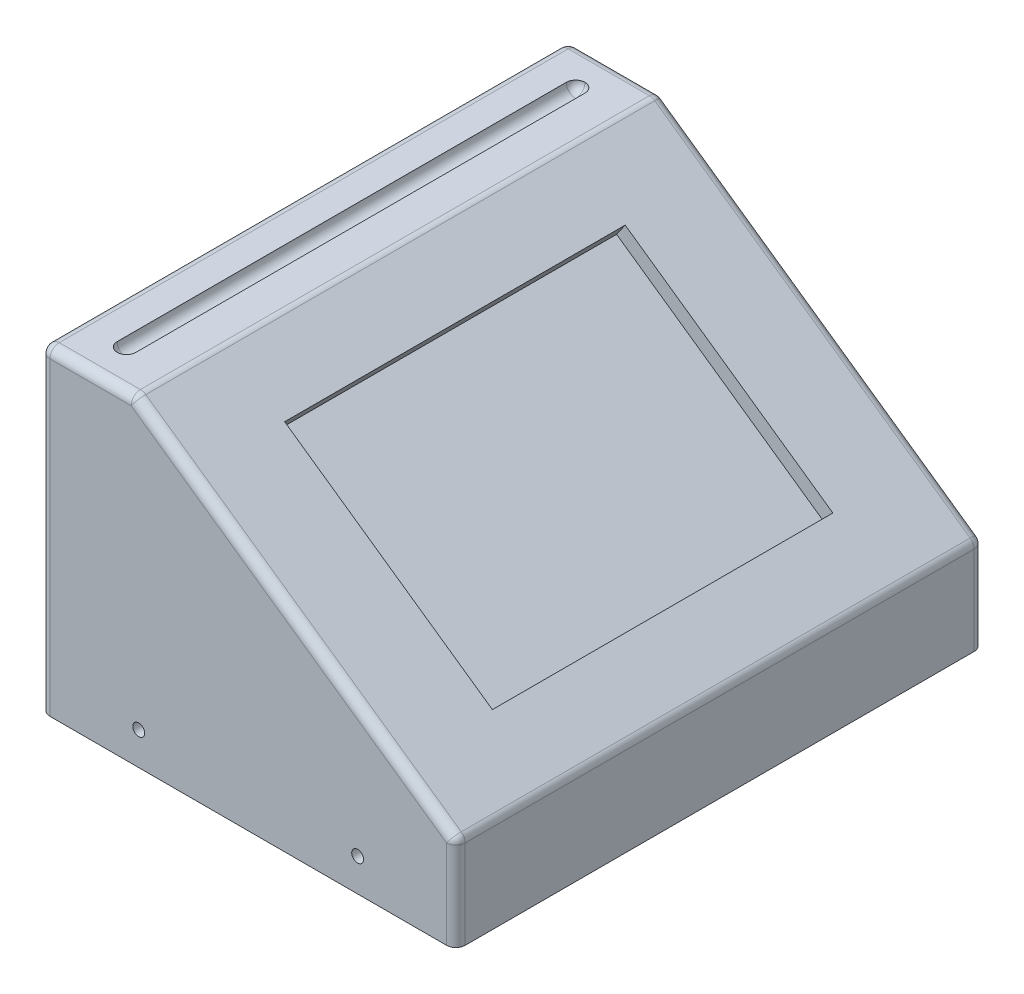
from build123d import *

# Parameters (mm, degrees)
SKETCH1_W           = 50
SKETCH1_H           = 170.451051634
BOSS_EXTRUDE1_DEPTH = 282
CUT_EXTRUDE1_DEPTH  = 8
CUT_EXTRUDE2_DEPTH  = 5
FILLET3_R           = 5
SKETCH5_R           = 3.175
CUT_EXTRUDE3_DEPTH  = 7.7
CUT_EXTRUDE4_START  = -7.7
SKETCH6_R           = 3.175
CUT_EXTRUDE4_DEPTH  = 7.7
FILLET4_R           = 5


with BuildPart() as part:
    # Sketch1 → Boss-Extrude1 (new body)
    with BuildSketch(Plane.XY):
        with Locations((-197.021929301, 35.225525817)):
            Rectangle(SKETCH1_W, SKETCH1_H)
        Polygon((0, -50), (0, 0), (-172.021929301, 120.451051634), (-172.021929301, -50), align=None)
    extrude(amount=BOSS_EXTRUDE1_DEPTH)

    # Sketch3 → Cut-Extrude1 (cut)
    with BuildSketch(Plane(origin=(0, 0, 0), x_dir=(0.819152044288989, -0.5735764363510502, 0), z_dir=(0.5735764363510502, 0.819152044288989, 0))):
        Polygon((-37.234042553, -232), (-172.765957447, -50), (-172.765957447, -232), align=None)
        Polygon((-37.234042553, -50), (-172.765957447, -50), (-37.234042553, -232), align=None)
    extrude(amount=-CUT_EXTRUDE1_DEPTH, mode=Mode.SUBTRACT)

    # Sketch4 → Cut-Extrude2 (cut)
    with BuildSketch(Plane(origin=(0, 120.451051634, 0), x_dir=(1, 0, 0), z_dir=(0, 1, 0))):
        Polygon((-202.021929301, -112.8), (-192.021929301, -169.2), (-192.021929301, -16), (-202.021929301, -16), align=None)
        Polygon((-192.021929301, -266), (-192.021929301, -169.2), (-202.021929301, -112.8), (-202.021929301, -266), align=None)
    extrude(amount=-CUT_EXTRUDE2_DEPTH, mode=Mode.SUBTRACT)

    # Fillet3
    # the kernel refuses this fillet: 5 mm, written as the material it adds along each edge
    with BuildSketch(Plane(origin=(-197.021929301, 120.451051634, 261), x_dir=(0, 0, 1), z_dir=(0, -1, 0))) as fillet3_piece_1_section:
        Polygon((0, 0), (FILLET3_R * 1.02, 0), (FILLET3_R * 1.02, FILLET3_R * 1.02), (0, FILLET3_R * 1.02), align=None)
    fillet3_piece_1 = extrude(amount=FILLET3_R * 1.02, mode=Mode.PRIVATE)
    fillet3_piece_1 = fillet3_piece_1 - Plane(origin=(-197.021929301, 120.451051634, 261), x_dir=(0.7071067811865475, 0, -0.7071067811865475), z_dir=(0, -1, 0)) * Sphere(FILLET3_R, mode=Mode.PRIVATE)
    with BuildSketch(Plane(origin=(-197.021929301, 120.451051634, 21), x_dir=(0, -1, 0), z_dir=(0, 0, -1))) as fillet3_piece_2_section:
        Polygon((0, 0), (FILLET3_R * 1.02, 0), (FILLET3_R * 1.02, FILLET3_R * 1.02), (0, FILLET3_R * 1.02), align=None)
    fillet3_piece_2 = extrude(amount=FILLET3_R * 1.02, mode=Mode.PRIVATE)
    fillet3_piece_2 = fillet3_piece_2 - Plane(origin=(-197.021929301, 120.451051634, 21), x_dir=(0.7071067811865474, 0.7071067811865478, 0), z_dir=(0, 0, -1)) * Sphere(FILLET3_R, mode=Mode.PRIVATE)
    with BuildSketch(Plane(origin=(-197.021929301, 120.451051634, 261), x_dir=(0, 0, 1), z_dir=(1, 0, 0))) as fillet3_piece_3_section:
        Polygon((0, 0), (FILLET3_R * 1.02, 0), (FILLET3_R * 1.02, FILLET3_R * 1.02), (0, FILLET3_R * 1.02), align=None)
    fillet3_piece_3 = extrude(amount=FILLET3_R * 1.02, mode=Mode.PRIVATE)
    fillet3_piece_3 = fillet3_piece_3 - Plane(origin=(-197.021929301, 120.451051634, 261), x_dir=(0, 0.7071067811865475, -0.7071067811865475), z_dir=(1, 0, 0)) * Sphere(FILLET3_R, mode=Mode.PRIVATE)
    with BuildSketch(Plane(origin=(-197.021929301, 120.451051634, 21), x_dir=(1, 0, 0), z_dir=(0, 0, -1))) as fillet3_piece_4_section:
        Polygon((0, 0), (FILLET3_R * 1.02, 0), (FILLET3_R * 1.02, FILLET3_R * 1.02), (0, FILLET3_R * 1.02), align=None)
    fillet3_piece_4 = extrude(amount=FILLET3_R * 1.02, mode=Mode.PRIVATE)
    fillet3_piece_4 = fillet3_piece_4 - Plane(origin=(-197.021929301, 120.451051634, 21), x_dir=(-0.7071067811865478, 0.7071067811865474, 0), z_dir=(0, 0, -1)) * Sphere(FILLET3_R, mode=Mode.PRIVATE)
    with BuildSketch(Plane(origin=(-192.021929301, 115.451051634, 261), x_dir=(0, 1, 0), z_dir=(0, 0, -1))) as fillet3_piece_5:
        with BuildLine():
            CenterArc((FILLET3_R, -FILLET3_R), FILLET3_R, 90, 90)
            Line((0, -FILLET3_R), (0, 0))
            Line((0, 0), (FILLET3_R, 0))
        make_face()
    fillet3_piece_5_solid = extrude(amount=240, mode=Mode.PRIVATE)
    with BuildSketch(Plane(origin=(-202.021929301, 115.451051634, 261), x_dir=(0, 1, 0), z_dir=(0, 0, -1))) as fillet3_piece_6:
        with BuildLine():
            CenterArc((FILLET3_R, FILLET3_R), FILLET3_R, 180, 90)
            Line((0, FILLET3_R), (0, 0))
            Line((0, 0), (FILLET3_R, 0))
        make_face()
    fillet3_piece_6_solid = extrude(amount=240, mode=Mode.PRIVATE)
    add([fillet3_piece_1, fillet3_piece_2, fillet3_piece_3, fillet3_piece_4, fillet3_piece_5_solid, fillet3_piece_6_solid])

    # Sketch5 → Cut-Extrude3 (cut)
    with BuildSketch(Plane.XY.offset(282)):
        with Locations((-52.5, -32.5)):
            Circle(SKETCH5_R)
        with Locations((-169.521929301, -32.5)):
            Circle(SKETCH5_R)
    extrude(amount=-CUT_EXTRUDE3_DEPTH, mode=Mode.SUBTRACT)

    # Sketch6 → Cut-Extrude4 (cut)
    with BuildSketch(Plane(origin=(0, 0, 0), x_dir=(-1, 0, 0), z_dir=(0, 0, -1)).offset(CUT_EXTRUDE4_START)):
        with Locations(Location((169.521929301, -32.5, 0), (0, 0, 180))):
            Circle(SKETCH6_R)
        with Locations(Location((52.5, -32.5, 0), (0, 0, 180))):
            Circle(SKETCH6_R)
    extrude(amount=CUT_EXTRUDE4_DEPTH, mode=Mode.SUBTRACT)

    # Fillet4
    fillet4_edges = [part.edges().sort_by_distance(p)[0] for p in [
        (-222.021929301, 35.225525817, 282),
        (-172.021929301, 120.451051634, 141),
        (0, 0, 141),
        (-222.021929301, 120.451051634, 141),
        (0, -25, 282),
        (-86.01096465, 60.225525817, 282),
        (-197.021929301, 120.451051634, 282),
        (-86.01096465, 60.225525817, 0),
        (0, -25, 0),
        (-222.021929301, 35.225525817, 0),
        (-197.021929301, 120.451051634, 0),
    ]]
    fillet(fillet4_edges, radius=FILLET4_R)


solid = part.part
